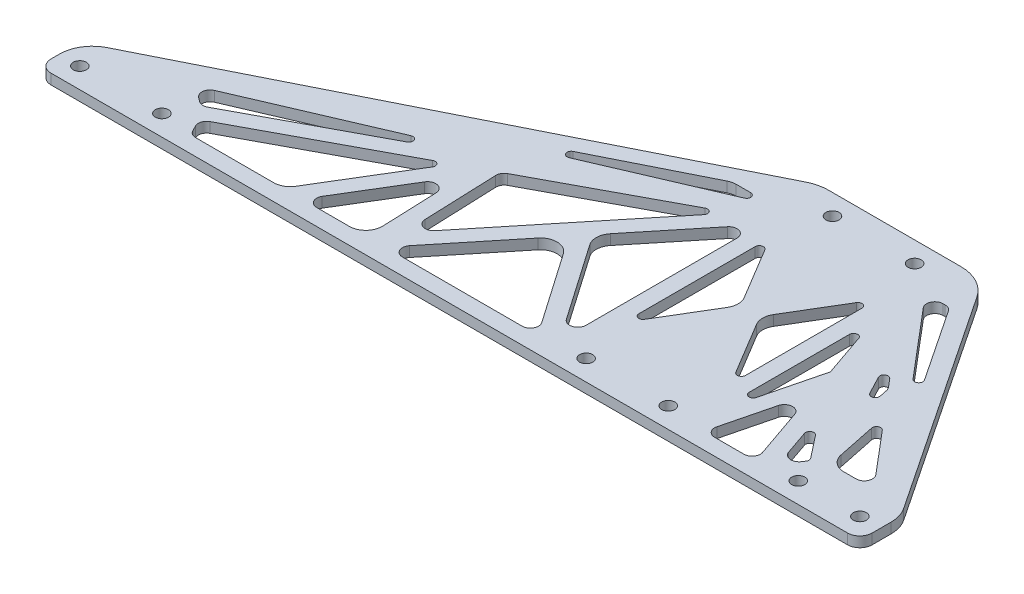
from build123d import *

# Parameters (mm, degrees)
SKETCH1_R           = 2.032
BOSS_EXTRUDE1_DEPTH = 3.175
SKETCH1_3_R         = 2.032
CUT_EXTRUDE2_DEPTH  = 270.126904313
FILLET1_R           = 3.81
FILLET2_R           = 10.16
FILLET3_R           = 12.7
FILLET4_R           = 1.27
FILLET5_R           = 2.54
FILLET6_R           = 5.08


with BuildPart() as part:
    # Sketch1 → Boss-Extrude1 (new body)
    with BuildSketch(Plane(origin=(0, 0, 0), x_dir=(1, 0, 0), z_dir=(0, 1, 0))):
        Polygon((0, 0), (254, 0), (254, 12.7), (203.2, 88.9), (152.4, 88.9), (0, 12.7), align=None)
        with Locations((6.35, 6.35)):
            Circle(SKETCH1_R, mode=Mode.SUBTRACT)
        with Locations((31.75, 6.35)):
            Circle(SKETCH1_R, mode=Mode.SUBTRACT)
        with Locations((228.6, 6.35)):
            Circle(SKETCH1_R, mode=Mode.SUBTRACT)
        with Locations((247.65, 6.35)):
            Circle(SKETCH1_R, mode=Mode.SUBTRACT)
        with Locations((162.983333333, 82.55)):
            Circle(SKETCH1_R, mode=Mode.SUBTRACT)
        with Locations((188.383333333, 82.55)):
            Circle(SKETCH1_R, mode=Mode.SUBTRACT)
    extrude(amount=BOSS_EXTRUDE1_DEPTH)

    # Sketch1<3> → Cut-Extrude2 (cut, through all)
    with BuildSketch(Plane(origin=(0, 0, 0), x_dir=(1, 0, 0), z_dir=(0, 1, 0))):
        Polygon((39.160127309, 10.433958769), (41.874510307, 5.08), (70.459110655, 5.08), (90.331883407, 37.826895453), align=None)
        Polygon((76.401361816, 5.08), (96.288373818, 5.08), (95.107733837, 35.904868603), align=None)
        Polygon((127.570752901, 36.414671497), (102.103358932, 5.08), (149.298298116, 5.08), align=None)
        Polygon((150.195302167, 76.2), (138.359225326, 76.2), (66.419120067, 40.229947371), align=None)
        Polygon((29.646805141, 18.912972806), (35.757110623, 14.374351834), (103.353340378, 50.559532546), align=None)
        Polygon((154.093333333, 69.047627429), (130.906568677, 40.519005519), (154.093333333, 7.079901082), align=None)
        Polygon((146.694432915, 67.998534414), (99.921228518, 42.960202251), (101.110396846, 11.912670369), align=None)
        with Locations((162.983333333, 6.35)):
            Circle(SKETCH1_3_R)
        Polygon((233.45048443, 34.366173115), (205.561266507, 76.2), (198.060312203, 76.2), align=None)
        Polygon((207.411621605, 31.741918623), (200.727780974, 5.08), (216.626583121, 5.08), align=None)
        with Locations((188.383333333, 6.35)):
            Circle(SKETCH1_3_R)
        Polygon((214.360813589, 27.186853093), (221.088734871, 7.720760975), (225.03662739, 13.595166828), align=None)
        Polygon((197.273333333, 61.075325647), (197.273333333, 12.191395039), (204.376138918, 40.524569775), align=None)
        Polygon((172.721209771, 44.45), (159.173333333, 67.029794062), (159.173333333, 21.870205938), align=None)
        Polygon((229.119714982, 15.811166321), (242.49351009, 15.811166321), (224.788319061, 36.740024529), align=None)
        Polygon((217.920532914, 44.858260713), (207.815682967, 56.802948088), (220.392582257, 32.913573338), align=None)
        Polygon((192.193333333, 67.029794062), (178.645456896, 44.45), (192.193333333, 21.870205938), align=None)
    extrude(amount=CUT_EXTRUDE2_DEPTH, mode=Mode.SUBTRACT)

    # Fillet1
    fillet1_edges = [part.edges().sort_by_distance(p)[0] for p in [
        (254, 1.5875, 0),
        (0, 1.5875, 0),
    ]]
    fillet(fillet1_edges, radius=FILLET1_R)

    # Fillet2
    fillet2_edges = [part.edges().sort_by_distance(p)[0] for p in [
        (254, 1.5875, -12.7),
        (0, 1.5875, -12.7),
    ]]
    fillet(fillet2_edges, radius=FILLET2_R)

    # Fillet3
    fillet3_edges = [part.edges().sort_by_distance(p)[0] for p in [
        (203.2, 1.5875, -88.9),
        (152.4, 1.5875, -88.9),
    ]]
    fillet(fillet3_edges, radius=FILLET3_R)

    # Fillet4
    fillet4_edges = [part.edges().sort_by_distance(p)[0] for p in [
        (214.360813589, 1.5875, -27.186853093),
        (233.45048443, 1.5875, -34.366173115),
        (207.815682967, 1.5875, -56.802948088),
        (220.392582257, 1.5875, -32.913573338),
        (197.273333333, 1.5875, -61.075325647),
        (197.273333333, 1.5875, -12.191395039),
        (159.173333333, 1.5875, -67.029794062),
        (192.193333333, 1.5875, -67.029794062),
        (192.193333333, 1.5875, -21.870205938),
        (159.173333333, 1.5875, -21.870205938),
        (146.694432915, 1.5875, -67.998534414),
        (66.419120067, 1.5875, -40.229947371),
        (150.195302167, 1.5875, -76.2),
        (224.788319061, 1.5875, -36.740024529),
        (103.353340378, 1.5875, -50.559532546),
        (90.331883407, 1.5875, -37.826895453),
        (225.03662739, 1.5875, -13.595166828),
    ]]
    fillet(fillet4_edges, radius=FILLET4_R)

    # Fillet5
    fillet5_edges = [part.edges().sort_by_distance(p)[0] for p in [
        (39.160127309, 1.5875, -10.433958769),
        (41.874510307, 1.5875, -5.08),
        (99.921228518, 1.5875, -42.960202251),
        (101.110396846, 1.5875, -11.912670369),
        (95.107733837, 1.5875, -35.904868603),
        (76.401361816, 1.5875, -5.08),
        (35.757110623, 1.5875, -14.374351834),
        (29.646805141, 1.5875, -18.912972806),
        (198.060312203, 1.5875, -76.2),
        (205.561266507, 1.5875, -76.2),
        (217.920532914, 1.5875, -44.858260713),
        (242.49351009, 1.5875, -15.811166321),
        (221.088734871, 1.5875, -7.720760975),
        (216.626583121, 1.5875, -5.08),
        (200.727780974, 1.5875, -5.08),
        (207.411621605, 1.5875, -31.741918623),
        (154.093333333, 1.5875, -69.047627429),
        (149.298298116, 1.5875, -5.08),
        (102.103358932, 1.5875, -5.08),
        (154.093333333, 1.5875, -7.079901082),
    ]]
    fillet(fillet5_edges, radius=FILLET5_R)

    # Fillet6
    fillet6_edges = [part.edges().sort_by_distance(p)[0] for p in [
        (229.119714982, 1.5875, -15.811166321),
        (96.288373818, 1.5875, -5.08),
        (172.721209771, 1.5875, -44.45),
        (178.645456896, 1.5875, -44.45),
        (130.906568677, 1.5875, -40.519005519),
        (127.570752901, 1.5875, -36.414671497),
        (138.359225326, 1.5875, -76.2),
        (70.459110655, 1.5875, -5.08),
    ]]
    fillet(fillet6_edges, radius=FILLET6_R)


solid = part.part
